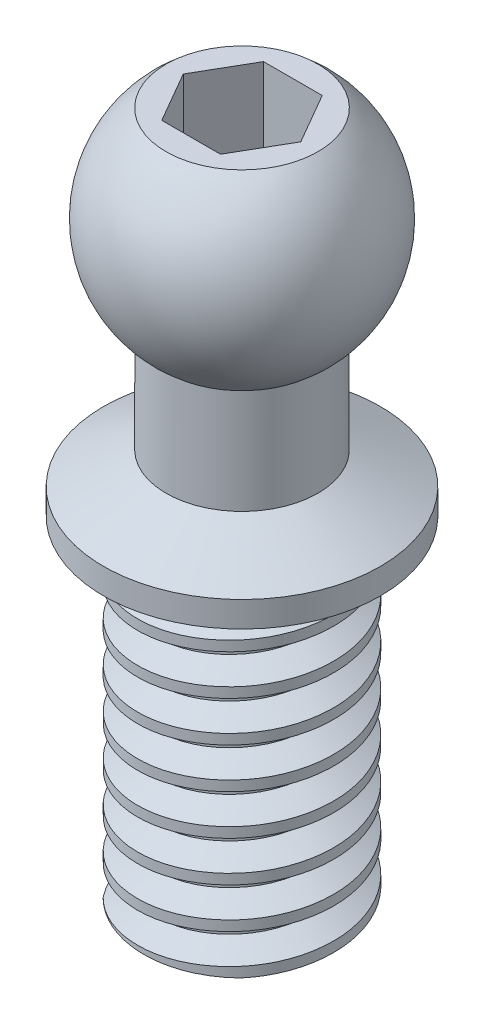
from build123d import *

# Parameters (mm, degrees)
SKETCH1_R           = 1.5
BOSS_EXTRUDE1_DEPTH = 6.5
THREAD1_PITCH       = 0.79375
THREAD1_TO          = 6.5
CUT_EXTRUDE1_DEPTH  = 3


with BuildPart() as part:
    # Sketch1 → Boss-Extrude1 (new body)
    with BuildSketch(Plane(origin=(0, 0, 0), x_dir=(1, 0, 0), z_dir=(0, 1, 0))):
        with Locations(Location((0, 0, 0), (0, 0, 90))):
            Circle(SKETCH1_R)
    extrude(amount=BOSS_EXTRUDE1_DEPTH)

    # Thread1: arcs per turn and ends read off the stored shape
    # Thread1: the profile of Thread Profile1 profile screwed along a right-hand helix through 8.188976 turns, 8 arcs to a turn; built about Z, then put on its axis
    thread1_z = Axis((0, 0, 0), (0, 0, 1))
    thread1_corners = [(1.4997, 0, -0.000173205), (1.4997, 0, 0.694704453), (1.929629788, 0, 0.446484374), (1.929629788, 0, 0.248046874)]
    with BuildLine(mode=Mode.PRIVATE) as thread1_profile:
        Line(thread1_corners[0], thread1_corners[1])
        Line(thread1_corners[1], thread1_corners[2])
        Line(thread1_corners[2], thread1_corners[3])
        Line(thread1_corners[3], thread1_corners[0])
    thread1_cap = Face(thread1_profile.wire())
    thread1_turn_angles = [0, 22.5, 45, 67.5, 90, 112.5, 135, 157.5, 180, 202.5, 225, 247.5, 270, 292.5, 315, 337.5, 360]
    thread1_turn_weights = [1, 0.9238795325112867, 1, 0.9238795325112867, 1, 0.9238795325112867, 1, 0.9238795325112867, 1, 0.9238795325112867, 1, 0.9238795325112867, 1, 0.9238795325112867, 1, 0.9238795325112867, 1]
    thread1_turn_rails = [Edge.make_bspline([Vector(p[0], p[1], 0).rotate(thread1_z, thread1_turn_angles[k]) / thread1_turn_weights[k] + Vector(0, 0, p[2] + THREAD1_PITCH * thread1_turn_angles[k] / 360) for k in range(17)], [0, 0, 0, 1, 1, 2, 2, 3, 3, 4, 4, 5, 5, 6, 6, 7, 7, 8, 8, 8], 2, thread1_turn_weights) for p in thread1_corners]
    thread1_turn_sides = [Face.make_surface_from_curves(thread1_turn_rails[p[0]], thread1_turn_rails[p[1]]) for p in [(0, 1), (1, 2), (2, 3), (3, 0)]]
    thread1_last_angles = [2880, 2902.5, 2925, 2936.515748031, 2948.031496063]
    thread1_last_weights = [1, 0.9238795325112867, 1, 0.9798698703335041, 1]
    thread1_last_rails = [Edge.make_bspline([Vector(p[0], p[1], 0).rotate(thread1_z, thread1_last_angles[k]) / thread1_last_weights[k] + Vector(0, 0, p[2] + THREAD1_PITCH * thread1_last_angles[k] / 360) for k in range(5)], [0, 0, 0, 1, 1, 2, 2, 2], 2, thread1_last_weights) for p in thread1_corners]
    thread1_last_sides = [Face.make_surface_from_curves(thread1_last_rails[p[0]], thread1_last_rails[p[1]]) for p in [(0, 1), (1, 2), (2, 3), (3, 0)]]
    thread1 = Plane(origin=(0, 6.5, 0), x_dir=(-1, 0, 0), z_dir=(0, -1, 0)) * split(Solid(Shell([*[p.moved(Location((0, 0, THREAD1_PITCH * i))) for i in range(8) for p in thread1_turn_sides], *thread1_last_sides, thread1_cap, thread1_cap.rotate(thread1_z, 2948.031496063).moved(Location((0, 0, THREAD1_PITCH * 2948.031496063 / 360)))])), bisect_by=Plane.XY.offset(THREAD1_TO), keep=Keep.BOTTOM, mode=Mode.PRIVATE)
    add(thread1)

    # Sketch8 → Revolve1 (revolve)
    with BuildSketch(Plane.XY, mode=Mode.PRIVATE) as revolve1_sk:
        with BuildLine():
            Line((-1.5, 6.5), (0, 6.5))
            Line((0, 6.5), (0, 13.446485313))
            Line((0, 13.446485313), (-1.4922, 13.446485313))
            ThreePointArc((-1.4922, 13.446485313), (-2.4, 11.566767472), (-1.4922, 9.687049632))
            Line((-1.4922, 9.687049632), (-1.4922, 7.632249632))
            Line((-1.4922, 7.632249632), (-2.722, 7.0032))
            Line((-2.722, 7.0032), (-2.722, 6.5))
            Line((-2.722, 6.5), (-1.5, 6.5))
        make_face()
    revolve(revolve1_sk.sketch.rotate(Axis((0, 6.5, 0), (0, 1, 0)), 180), axis=Axis((0, 6.5, 0), (0, 1, 0)))

    # Sketch13 → Cut-Extrude1 (cut)
    with BuildSketch(Plane(origin=(0, 13.446485313, 0), x_dir=(1, 0, 0), z_dir=(0, 1, 0))):
        Polygon((0.577350269, 1), (-0.577350269, 1), (-1.154700538, 0), (-0.577350269, -1), (0.577350269, -1), (1.154700538, 0), align=None)
    extrude(amount=-CUT_EXTRUDE1_DEPTH, mode=Mode.SUBTRACT)


solid = part.part
